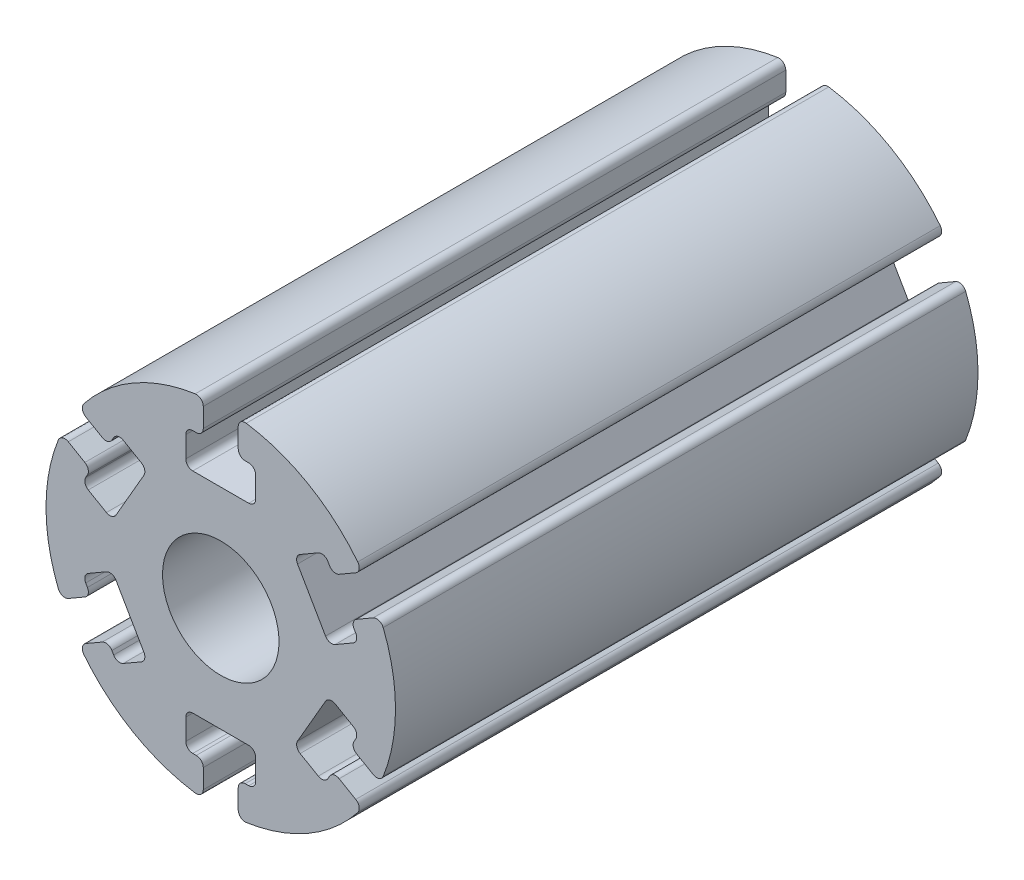
from build123d import *

# Parameters (mm, degrees)
ESBO_O1_R                = 7.5
RESSALTO_EXTRUS_O1_DEPTH = 12.5
ESBO_O7_R                = 2.5
CORTE_EXTRUS_O1_DEPTH    = 16
CORTE_EXTRUS_O2_DEPTH    = 28.156951228
FILETE2_R                = 0.3
ESBO_O10_R               = 2.5
CORTE_EXTRUS_O3_DEPTH    = 10


with BuildPart() as part:
    # Esboço1 → Ressalto-extrusão1 (new, symmetric)
    with BuildSketch(Plane.XY):
        Circle(ESBO_O1_R)
    extrude(amount=RESSALTO_EXTRUS_O1_DEPTH, both=True)

    # Esboço7 → Corte-extrusão1 (cut)
    with BuildSketch(Plane(origin=(0, 0, 12.5), x_dir=(-1, 0, 0), z_dir=(0, 0, -1))):
        Circle(ESBO_O7_R)
    extrude(amount=CORTE_EXTRUS_O1_DEPTH, mode=Mode.SUBTRACT)

    # Esboço9 → Corte-extrusão2 (cut, through all)
    with BuildSketch(Plane.XY.offset(12.5)):
        Polygon((-0.75, 6), (-0.75, 7.5), (0.75, 7.5), (0.75, 6), (1.5, 6), (1.5, 4.5), (-1.5, 4.5), (-1.5, 6), align=None)
        Polygon((4.446152423, 4.299038106), (3.147114317, 3.549038106), (4.647114317, 0.950961894), (5.946152423, 1.700961894), (5.571152423, 2.350480947), (6.870190528, 3.100480947), (6.120190528, 4.399519053), (4.821152423, 3.649519053), align=None)
        Polygon((5.946152423, -1.700961894), (4.647114317, -0.950961894), (3.147114317, -3.549038106), (4.446152423, -4.299038106), (4.821152423, -3.649519053), (6.120190528, -4.399519053), (6.870190528, -3.100480947), (5.571152423, -2.350480947), align=None)
        Polygon((1.5, -6), (1.5, -4.5), (-1.5, -4.5), (-1.5, -6), (-0.75, -6), (-0.75, -7.5), (0.75, -7.5), (0.75, -6), align=None)
        Polygon((-4.446152423, -4.299038106), (-3.147114317, -3.549038106), (-4.647114317, -0.950961894), (-5.946152423, -1.700961894), (-5.571152423, -2.350480947), (-6.870190528, -3.100480947), (-6.120190528, -4.399519053), (-4.821152423, -3.649519053), align=None)
        Polygon((-5.946152423, 1.700961894), (-4.647114317, 0.950961894), (-3.147114317, 3.549038106), (-4.446152423, 4.299038106), (-4.821152423, 3.649519053), (-6.120190528, 4.399519053), (-6.870190528, 3.100480947), (-5.571152423, 2.350480947), align=None)
    extrude(amount=-CORTE_EXTRUS_O2_DEPTH, mode=Mode.SUBTRACT)

    # Filete2
    filete2_edges = [part.edges().sort_by_distance(p)[0] for p in [
        (0.75, 7.462405778, 0),
        (6.087632977, 4.380721942, 0),
        (4.821152423, 3.649519053, 0),
        (4.446152423, 4.299038106, 0),
        (3.147114317, 3.549038106, 0),
        (4.647114317, 0.950961894, 0),
        (5.946152423, 1.700961894, 0),
        (5.571152423, 2.350480947, 0),
        (6.837632977, 3.081683836, 0),
        (6.837632977, -3.081683836, 0),
        (5.571152423, -2.350480947, 0),
        (5.946152423, -1.700961894, 0),
        (4.647114317, -0.950961894, 0),
        (3.147114317, -3.549038106, 0),
        (4.446152423, -4.299038106, 0),
        (4.821152423, -3.649519053, 0),
        (6.087632977, -4.380721942, 0),
        (0.75, -7.462405778, 0),
        (0.75, -6, 0),
        (1.5, -6, 0),
        (1.5, -4.5, 0),
        (-1.5, -4.5, 0),
        (-1.5, -6, 0),
        (-0.75, -6, 0),
        (-0.75, -7.462405778, 0),
        (-6.087632977, -4.380721942, 0),
        (-4.821152423, -3.649519053, 0),
        (-4.446152423, -4.299038106, 0),
        (-3.147114317, -3.549038106, 0),
        (-4.647114317, -0.950961894, 0),
        (-5.946152423, -1.700961894, 0),
        (-5.571152423, -2.350480947, 0),
        (-6.837632977, -3.081683836, 0),
        (-6.837632977, 3.081683836, 0),
        (-5.571152423, 2.350480947, 0),
        (-5.946152423, 1.700961894, 0),
        (-4.647114317, 0.950961894, 0),
        (-3.147114317, 3.549038106, 0),
        (-4.446152423, 4.299038106, 0),
        (-4.821152423, 3.649519053, 0),
        (-6.087632977, 4.380721942, 0),
        (-0.75, 7.462405778, 0),
        (-0.75, 6, 0),
        (-1.5, 6, 0),
        (1.5, 6, 0),
        (0.75, 6, 0),
        (1.5, 4.5, 0),
        (-1.5, 4.5, 0),
    ]]
    fillet(filete2_edges, radius=FILETE2_R)

    # Esboço10 → Corte-extrusão3 (cut)
    with BuildSketch(Plane(origin=(0, 0, 0), x_dir=(1, 0, 0), z_dir=(0, 1, 0))):
        with Locations((0, -6)):
            Circle(ESBO_O10_R)
    extrude(amount=-CORTE_EXTRUS_O3_DEPTH, mode=Mode.SUBTRACT)


solid = part.part
